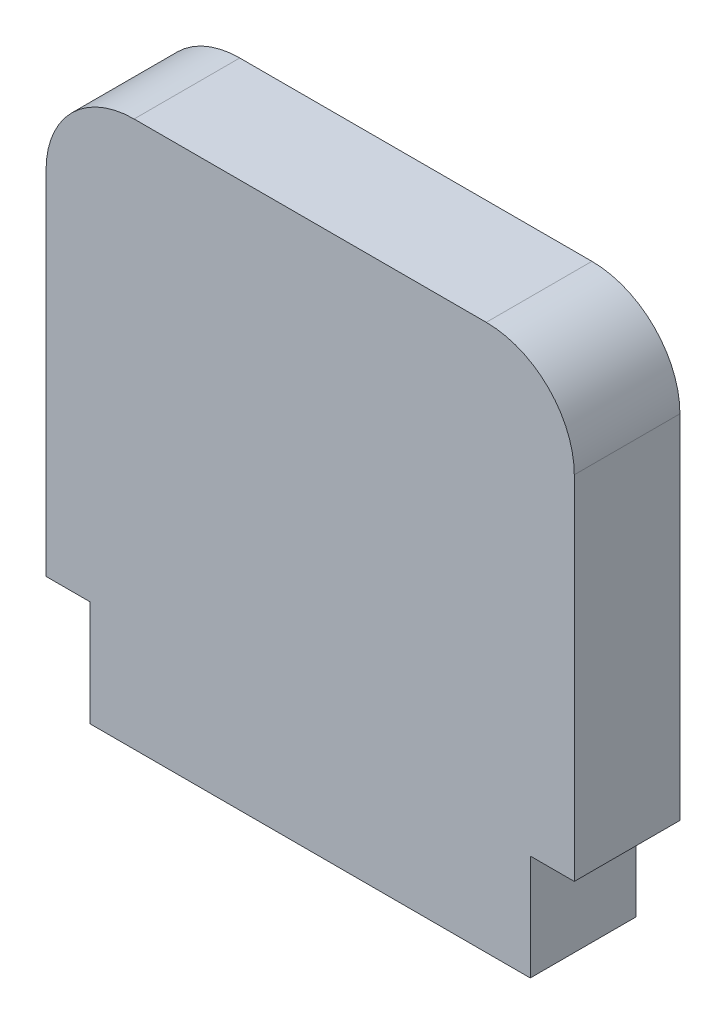
from build123d import *

# Parameters (mm, degrees)
RESSALTO_EXTRUS_O1_DEPTH = 6
FILETE1_R                = 5


with BuildPart() as part:
    # Esboço1 → Ressalto-extrusão1 (new body)
    with BuildSketch(Plane.XY):
        Polygon((-15, 12.5), (-15, -12.5), (-12.5, -12.5), (-12.5, -18.5), (12.5, -18.5), (12.5, -12.5), (15, -12.5), (15, 12.5), align=None)
    extrude(amount=RESSALTO_EXTRUS_O1_DEPTH)

    # Filete1
    filete1_edges = [part.edges().sort_by_distance(p)[0] for p in [
        (15, 12.5, 3),
        (-15, 12.5, 3),
    ]]
    fillet(filete1_edges, radius=FILETE1_R)


solid = part.part
